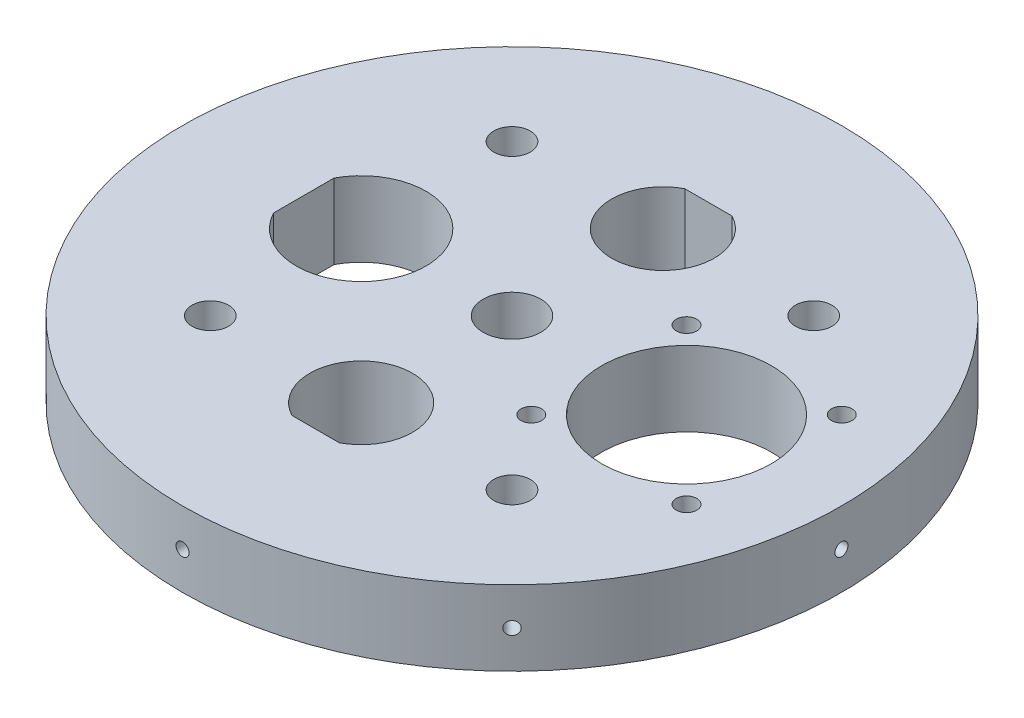
from build123d import *

# Parameters (mm, degrees)
SKETCH2_R           = 57.15
BOSS_EXTRUDE1_DEPTH = 13
CUT_EXTRUDE1_REACH  = 83.861
SKETCH6_R           = 3.175
SKETCH7_R           = 14.732
SKETCH7_R_2         = 1.778
CUT_EXTRUDE2_DEPTH  = 82.861132413
SKETCH8_R           = 5
CUT_EXTRUDE3_DEPTH  = 82.861132413
CIRPATTERN1_COUNT   = 8


with BuildPart() as part:
    # Sketch2 → Boss-Extrude1 (new body)
    with BuildSketch(Plane(origin=(0, 0, 0), x_dir=(1, 0, 0), z_dir=(0, 1, 0))):
        Circle(SKETCH2_R)
    extrude(amount=BOSS_EXTRUDE1_DEPTH)

    # Sketch6 → Cut-Extrude1 (cut, up to next)
    with BuildSketch(Plane(origin=(0, 13, 0), x_dir=(1, 0, 0), z_dir=(0, 1, 0)), mode=Mode.PRIVATE) as cut_extrude1_sk1:
        with Locations((-26.1629, -26.1629)):
            Circle(SKETCH6_R)
    cut_extrude1_tool1 = extrude(cut_extrude1_sk1.sketch, amount=-CUT_EXTRUDE1_REACH, mode=Mode.PRIVATE) & part.part
    # Sketch6 → Cut-Extrude1 (cut, up to next)
    with BuildSketch(Plane(origin=(0, 13, 0), x_dir=(1, 0, 0), z_dir=(0, 1, 0)), mode=Mode.PRIVATE) as cut_extrude1_sk2:
        with Locations((26.1629, -26.1629)):
            Circle(SKETCH6_R)
    cut_extrude1_tool2 = extrude(cut_extrude1_sk2.sketch, amount=-CUT_EXTRUDE1_REACH, mode=Mode.PRIVATE) & part.part
    # Sketch6 → Cut-Extrude1 (cut, up to next)
    with BuildSketch(Plane(origin=(0, 13, 0), x_dir=(1, 0, 0), z_dir=(0, 1, 0)), mode=Mode.PRIVATE) as cut_extrude1_sk3:
        with Locations((-26.1629, 26.163103615)):
            Circle(SKETCH6_R)
    cut_extrude1_tool3 = extrude(cut_extrude1_sk3.sketch, amount=-CUT_EXTRUDE1_REACH, mode=Mode.PRIVATE) & part.part
    # Sketch6 → Cut-Extrude1 (cut, up to next)
    with BuildSketch(Plane(origin=(0, 13, 0), x_dir=(1, 0, 0), z_dir=(0, 1, 0)), mode=Mode.PRIVATE) as cut_extrude1_sk4:
        with Locations((26.1629, 26.163103615)):
            Circle(SKETCH6_R)
    cut_extrude1_tool4 = extrude(cut_extrude1_sk4.sketch, amount=-CUT_EXTRUDE1_REACH, mode=Mode.PRIVATE) & part.part
    add(cut_extrude1_tool1.solids().sort_by_distance((-26.1629, 13, 26.1629))[0], mode=Mode.SUBTRACT)
    add(cut_extrude1_tool2.solids().sort_by_distance((26.1629, 13, 26.1629))[0], mode=Mode.SUBTRACT)
    add(cut_extrude1_tool3.solids().sort_by_distance((-26.1629, 13, -26.163104))[0], mode=Mode.SUBTRACT)
    add(cut_extrude1_tool4.solids().sort_by_distance((26.1629, 13, -26.163104))[0], mode=Mode.SUBTRACT)

    # Sketch7 → Cut-Extrude2 (cut, through all)
    with BuildSketch(Plane(origin=(0, 13, 0), x_dir=(1, 0, 0), z_dir=(0, 1, 0))):
        with Locations((30, 0.269903496)):
            Circle(SKETCH7_R)
        with Locations((16.54, -13.194096504)):
            Circle(SKETCH7_R_2)
        with Locations((16.54, 13.729903496)):
            Circle(SKETCH7_R_2)
        with Locations((43.46, 13.729903496)):
            Circle(SKETCH7_R_2)
        with Locations((43.46, -13.194096504)):
            Circle(SKETCH7_R_2)
    extrude(amount=-CUT_EXTRUDE2_DEPTH, mode=Mode.SUBTRACT)

    # Sketch8 → Cut-Extrude3 (cut, through all)
    with BuildSketch(Plane(origin=(0, 13, 0), x_dir=(1, 0, 0), z_dir=(0, 1, 0))):
        Circle(SKETCH8_R)
        with BuildLine():
            Line((4.098780306, 34.063103615), (-4.098780306, 34.063103615))
            ThreePointArc((-4.098780306, 34.063103615), (0, 17.263103615), (4.098780306, 34.063103615))
        make_face()
        with BuildLine():
            Line((4.098780306, -34.0629), (-4.098780306, -34.0629))
            ThreePointArc((-4.098780306, -34.0629), (0, -17.2629), (4.098780306, -34.0629))
        make_face()
        with BuildLine():
            Line((-36.1129, 5.249761899), (-36.1129, -5.249761899))
            ThreePointArc((-36.1129, -5.249761899), (-14.9129, 0), (-36.1129, 5.249761899))
        make_face()
    extrude(amount=-CUT_EXTRUDE3_DEPTH, mode=Mode.SUBTRACT)

    # Sketch16 → #4-40 Tapped Hole2 (revolve, cut)
    with BuildSketch(Plane(origin=(0, 6.5, -57.15), x_dir=(0, 1, 0), z_dir=(1, 0, 0))):
        Polygon((0, 0), (0, 10.679152758), (1.1303, 10), (1.1303, 0), align=None)
    f_4_40_tapped_hole2 = revolve(axis=Axis((0, 6.5, -63.5), (0, 0, 1)), mode=Mode.SUBTRACT)

    # CirPattern1: #4-40 Tapped Hole2 ×8 about axis
    cirpattern1_axis = Axis((0, 0, 0), (0, 1, 0))
    for i in range(1, CIRPATTERN1_COUNT):
        add(f_4_40_tapped_hole2.rotate(cirpattern1_axis, i * 360 / CIRPATTERN1_COUNT), mode=Mode.SUBTRACT)


solid = part.part
